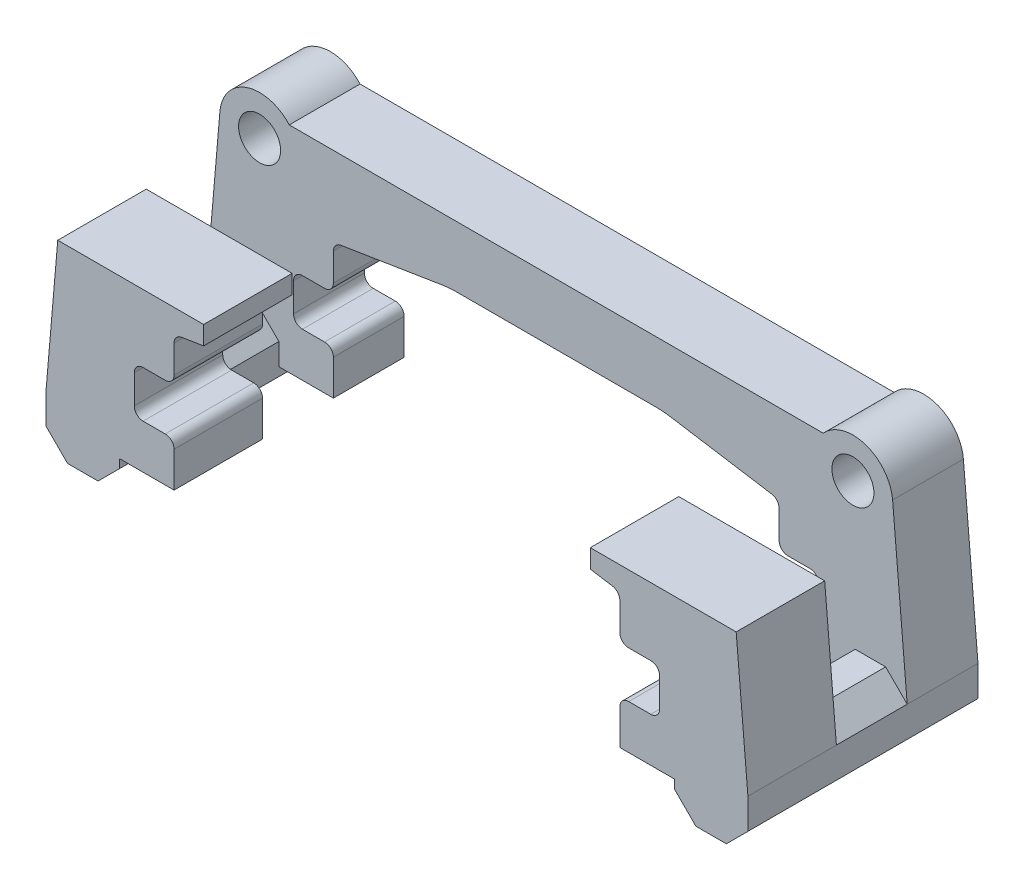
from build123d import *

# Parameters (mm, degrees)
SKETCH1_R           = 5.115
SKETCH1_R_2         = 4.75
BOSS_EXTRUDE1_DEPTH = 16
CUT_EXTRUDE1_DEPTH  = 96.114961321
SKETCH3_R           = 5.115
BOSS_EXTRUDE2_DEPTH = 16
BOSS_EXTRUDE3_DEPTH = 20


with BuildPart() as part:
    # Sketch1 → Boss-Extrude1 (new body)
    with BuildSketch(Plane.XY):
        with BuildLine():
            Line((-79.314915793, 3.444150891), (-76.013981248, 41.772249209))
            ThreePointArc((-76.013981248, 41.772249209), (-69.894570546, 49.5377007), (-60.338970127, 47))
            Line((-60.338970127, 47), (60.338970127, 47))
            ThreePointArc((60.338970127, 47), (69.894570546, 49.5377007), (76.013981248, 41.772249209))
            Line((76.013981248, 41.772249209), (79.314915793, 3.444150891))
            Line((79.314915793, 3.444150891), (79.314915793, -3.444150891))
            Line((79.314915793, -3.444150891), (74.444150891, -8.314915793))
            Line((74.444150891, -8.314915793), (67.555849109, -8.314915793))
            Line((67.555849109, -8.314915793), (62.685084207, -3.444150891))
            Line((62.685084207, -3.444150891), (62.685084207, -1.5))
            Line((62.685084207, -1.5), (-62.685084207, -1.5))
            Line((-62.685084207, -1.5), (-62.685084207, -3.444150891))
            Line((-62.685084207, -3.444150891), (-67.555849109, -8.314915793))
            Line((-67.555849109, -8.314915793), (-74.444150891, -8.314915793))
            Line((-74.444150891, -8.314915793), (-79.314915793, -3.444150891))
            Line((-79.314915793, -3.444150891), (-79.314915793, 3.444150891))
        make_face()
        with Locations((-71, 0)):
            Circle(SKETCH1_R, mode=Mode.SUBTRACT)
        with Locations((-67.047174059, 41)):
            Circle(SKETCH1_R_2, mode=Mode.SUBTRACT)
        with Locations((67.047174059, 41)):
            Circle(SKETCH1_R_2, mode=Mode.SUBTRACT)
        with Locations((71, 0)):
            Circle(SKETCH1_R, mode=Mode.SUBTRACT)
    extrude(amount=BOSS_EXTRUDE1_DEPTH)

    # Sketch2 → Cut-Extrude1 (cut, through all)
    with BuildSketch(Plane(origin=(0, 0, 0), x_dir=(-1, 0, 0), z_dir=(0, 0, -1))):
        with BuildLine():
            Line((-50.370168415, 6.5), (-50.370168415, -1.5))
            Line((-50.370168415, -1.5), (-25.72087261, -5.45872537))
            ThreePointArc((-25.72087261, -5.45872537), (-24.140212323, -5.648408909), (-22.549472845, -5.711770579))
            Line((-22.549472845, -5.711770579), (22.549472845, -5.711770579))
            ThreePointArc((22.549472845, -5.711770579), (24.140212323, -5.648408909), (25.72087261, -5.45872537))
            Line((25.72087261, -5.45872537), (50.370168415, -1.5))
            Line((50.370168415, -1.5), (50.370168415, 6.5))
            ThreePointArc((50.370168415, 6.5), (50.955954852, 7.914213562), (52.370168415, 8.5))
            Line((52.370168415, 8.5), (57.370168415, 8.5))
            ThreePointArc((57.370168415, 8.5), (58.784381977, 9.085786438), (59.370168415, 10.5))
            Line((59.370168415, 10.5), (59.370168415, 17))
            ThreePointArc((59.370168415, 17), (58.784381977, 18.414213562), (57.370168415, 19))
            Line((57.370168415, 19), (52.370168415, 19))
            ThreePointArc((52.370168415, 19), (50.955954852, 19.585786438), (50.370168415, 21))
            Line((50.370168415, 21), (50.370168415, 27.295575149))
            ThreePointArc((50.370168415, 27.295575149), (49.892383898, 28.592826098), (48.687308391, 29.270270629))
            Line((48.687308391, 29.270270629), (25.72087261, 32.95872537))
            ThreePointArc((25.72087261, 32.95872537), (24.140212323, 33.148408909), (22.549472845, 33.211770579))
            Line((22.549472845, 33.211770579), (-22.549472845, 33.211770579))
            ThreePointArc((-22.549472845, 33.211770579), (-24.140212323, 33.148408909), (-25.72087261, 32.95872537))
            Line((-25.72087261, 32.95872537), (-48.687308391, 29.270270629))
            ThreePointArc((-48.687308391, 29.270270629), (-49.892383898, 28.592826098), (-50.370168415, 27.295575149))
            Line((-50.370168415, 27.295575149), (-50.370168415, 21))
            ThreePointArc((-50.370168415, 21), (-50.955954852, 19.585786438), (-52.370168415, 19))
            Line((-52.370168415, 19), (-57.370168415, 19))
            ThreePointArc((-57.370168415, 19), (-58.784381977, 18.414213562), (-59.370168415, 17))
            Line((-59.370168415, 17), (-59.370168415, 10.5))
            ThreePointArc((-59.370168415, 10.5), (-58.784381977, 9.085786438), (-57.370168415, 8.5))
            Line((-57.370168415, 8.5), (-52.370168415, 8.5))
            ThreePointArc((-52.370168415, 8.5), (-50.955954852, 7.914213562), (-50.370168415, 6.5))
        make_face()
    extrude(amount=-CUT_EXTRUDE1_DEPTH, mode=Mode.SUBTRACT)

    # Sketch3 → Boss-Extrude2 (add)
    with BuildSketch(Plane.XY.offset(16)):
        Polygon((-79.314915793, 3.444150891), (-79.314915793, -3.444150891), (-74.444150891, -8.314915793), (-67.555849109, -8.314915793), (-62.685084207, -3.444150891), (-62.685084207, 3.444150891), (-67.555849109, 8.314915793), (-74.444150891, 8.314915793), align=None)
        with Locations((-71, 0)):
            Circle(SKETCH3_R, mode=Mode.SUBTRACT)
    boss_extrude2 = extrude(amount=BOSS_EXTRUDE2_DEPTH)

    # Mirror1: Boss-Extrude2 across plane
    add(boss_extrude2.mirror(Plane(origin=(0, 0, 0), x_dir=(0, 0, 1), z_dir=(1, 0, 0))))

    # Sketch4 → Boss-Extrude3 (add)
    with BuildSketch(Plane.XY.offset(32)):
        with BuildLine():
            Line((-50.370168415, 6.5), (-50.370168415, -1.5))
            Line((-50.370168415, -1.5), (-62.685084207, -1.5))
            Line((-62.685084207, -1.5), (-62.685084207, -3.444150891))
            Line((-62.685084207, -3.444150891), (-67.555849109, -8.314915793))
            Line((-67.555849109, -8.314915793), (-74.444150891, -8.314915793))
            Line((-74.444150891, -8.314915793), (-79.314915793, -3.444150891))
            Line((-79.314915793, -3.444150891), (-79.314915793, 3.444150891))
            Line((-79.314915793, 3.444150891), (-76.66007488, 34.270270629))
            Line((-76.66007488, 34.270270629), (-43.687308391, 34.270270629))
            Line((-43.687308391, 34.270270629), (-43.687308391, 30.073280459))
            Line((-43.687308391, 30.073280459), (-48.687308391, 29.270270629))
            ThreePointArc((-48.687308391, 29.270270629), (-49.892383898, 28.592826098), (-50.370168415, 27.295575149))
            Line((-50.370168415, 27.295575149), (-50.370168415, 21))
            ThreePointArc((-50.370168415, 21), (-50.955954852, 19.585786438), (-52.370168415, 19))
            Line((-52.370168415, 19), (-57.370168415, 19))
            ThreePointArc((-57.370168415, 19), (-58.784381977, 18.414213562), (-59.370168415, 17))
            Line((-59.370168415, 17), (-59.370168415, 10.5))
            ThreePointArc((-59.370168415, 10.5), (-58.784381977, 9.085786438), (-57.370168415, 8.5))
            Line((-57.370168415, 8.5), (-52.370168415, 8.5))
            ThreePointArc((-52.370168415, 8.5), (-50.955954852, 7.914213562), (-50.370168415, 6.5))
        make_face()
    boss_extrude3 = extrude(amount=BOSS_EXTRUDE3_DEPTH)

    # Mirror2: Boss-Extrude3 across plane
    add(boss_extrude3.mirror(Plane(origin=(0, 0, 0), x_dir=(0, 0, 1), z_dir=(1, 0, 0))))


solid = part.part
